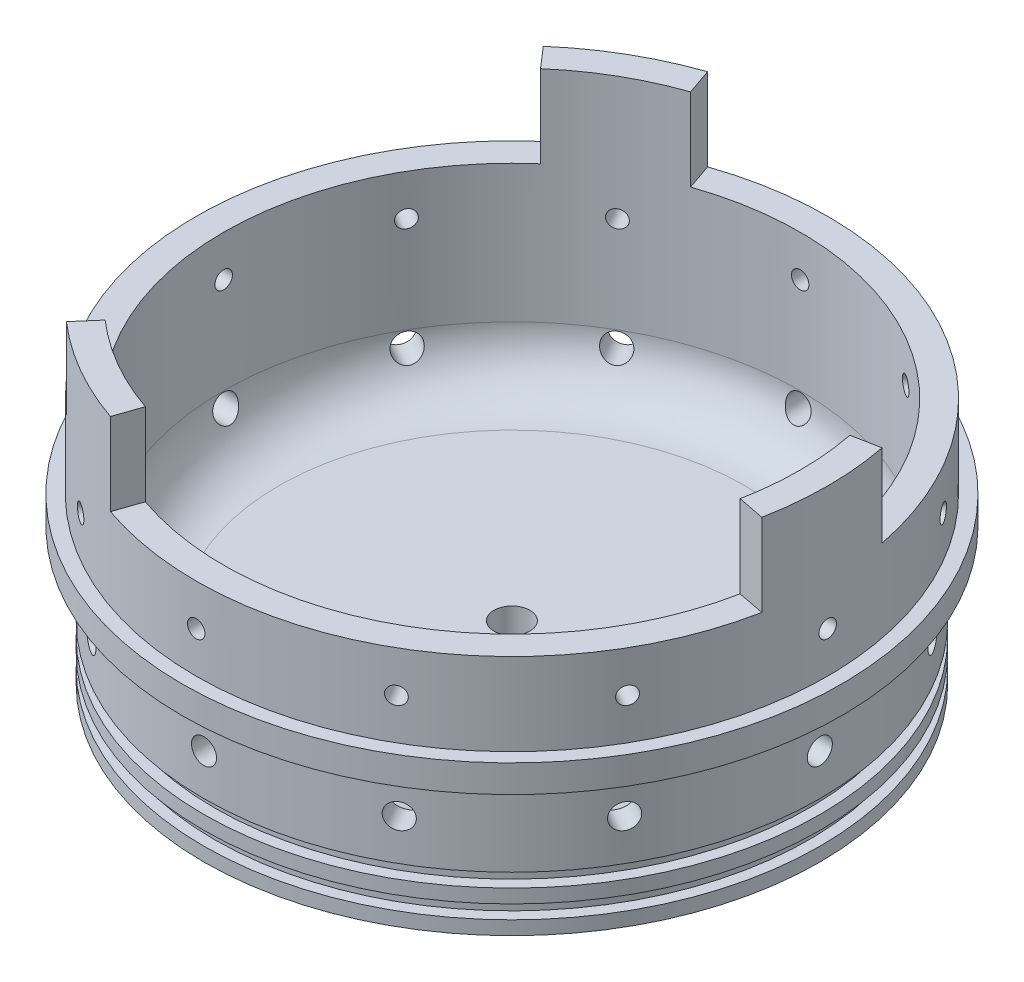
from build123d import *

# Parameters (mm, degrees)
SKETCH1_R                                = 76.2
CENTER_RING_TOTOD_THK_DEPTH              = 6.35
SKETCH2_R                                = 73.025
TOP_RING_ACRYLICID_HGT_DEPTH             = 38.1
SKETCH3_R                                = 71.247
LOWER_RING_TANKID_DEPTH_DEPTH            = 31.75
SKETCH4_R                                = 66.675
BULKHEAD_HOLLOW_UPPERWALL_BLKHDTHK_DEPTH = 63.5
SKETCH5_W                                = 2.54
SKETCH5_H                                = 3.175
SKETCH8_R                                = 2.8956
LOWER_BOLT_HOLE_DRILLDIA_DIST_DEPTH      = 117.570504417
LOWER_BOLT_HOLE_AMMOUNT_COUNT            = 12
SKETCH9_R                                = 2.0193
UPPER_BOLT_HOLE_DRILLDIA_DIST_DEPTH      = 117.570504455
CIRPATTERN1_COUNT                        = 12
SMOOTHING_R                              = 12.7
CUT_EXTRUDE1_DEPTH                       = 19.05
SKETCH11_R                               = 4.1671875
F_1_8NPTHOLE_DEPTH                       = 126.080494134


with BuildPart() as part:
    # Sketch1 → Center Ring(TotOD&Thk) (new body)
    with BuildSketch(Plane(origin=(0, 0, 0), x_dir=(1, 0, 0), z_dir=(0, 1, 0))):
        with Locations(Location((0, 0, 0), (0, 0, 270))):
            Circle(SKETCH1_R)
    extrude(amount=CENTER_RING_TOTOD_THK_DEPTH)

    # Sketch2 → Top Ring(AcrylicID&Hgt) (add)
    with BuildSketch(Plane(origin=(0, 6.35, 0), x_dir=(1, 0, 0), z_dir=(0, 1, 0))):
        with Locations(Location((0, 0, 0), (0, 0, 90))):
            Circle(SKETCH2_R)
    extrude(amount=TOP_RING_ACRYLICID_HGT_DEPTH)

    # Sketch3 → Lower Ring(TankID&Depth) (add)
    with BuildSketch(Plane.XZ):
        with Locations(Location((0, 0, 0), (0, 0, 270))):
            Circle(SKETCH3_R)
    extrude(amount=LOWER_RING_TANKID_DEPTH_DEPTH)

    # Sketch4 → Bulkhead Hollow(UpperWall&BlkhdThk (cut)
    with BuildSketch(Plane(origin=(0, 44.45, 0), x_dir=(1, 0, 0), z_dir=(0, 1, 0))):
        with Locations(Location((0, 0, 0), (0, 0, 270))):
            Circle(SKETCH4_R)
    extrude(amount=-BULKHEAD_HOLLOW_UPPERWALL_BLKHDTHK_DEPTH, mode=Mode.SUBTRACT)

    # Sketch5 → O-Ring Channel (revolve, cut)
    with BuildSketch(Plane.XY, mode=Mode.PRIVATE) as o_ring_channel_sk:
        with Locations((-69.977, -26.9875)):
            Rectangle(SKETCH5_W, SKETCH5_H)
        with Locations((-69.977, -20.6375)):
            Rectangle(SKETCH5_W, SKETCH5_H)
    revolve(o_ring_channel_sk.sketch.rotate(Axis((0, 0, 0), (0, -1, 0)), 270), axis=Axis((0, 0, 0), (0, -1, 0)), mode=Mode.SUBTRACT)

    # Sketch8 → Lower Bolt Hole (DrillDia&Dist) (cut, through all)
    with BuildSketch(Plane.XY):
        with Locations(Location((0, -9.525, 0), (0, 0, 270))):
            Circle(SKETCH8_R)
    lower_bolt_hole_drilldia_dist = extrude(amount=LOWER_BOLT_HOLE_DRILLDIA_DIST_DEPTH, mode=Mode.SUBTRACT)

    # Lower Bolt Hole Ammount: Lower Bolt Hole (DrillDia&Dist) ×12 about axis
    lower_bolt_hole_ammount_axis = Axis((0, -31.75, 0), (0, 1, 0))
    for i in range(1, LOWER_BOLT_HOLE_AMMOUNT_COUNT):
        add(lower_bolt_hole_drilldia_dist.rotate(lower_bolt_hole_ammount_axis, i * 360 / LOWER_BOLT_HOLE_AMMOUNT_COUNT), mode=Mode.SUBTRACT)

    # Sketch9 → Upper Bolt Hole (DrillDia&Dist) (cut, through all)
    with BuildSketch(Plane.XY):
        with Locations((0, 15.875)):
            Circle(SKETCH9_R)
    upper_bolt_hole_drilldia_dist = extrude(amount=-UPPER_BOLT_HOLE_DRILLDIA_DIST_DEPTH, mode=Mode.SUBTRACT)

    # CirPattern1: Upper Bolt Hole (DrillDia&Dist) ×12 about axis
    cirpattern1_axis = Axis((0, 44.45, 0), (0, -1, 0))
    for i in range(1, CIRPATTERN1_COUNT):
        add(upper_bolt_hole_drilldia_dist.rotate(cirpattern1_axis, i * 360 / CIRPATTERN1_COUNT), mode=Mode.SUBTRACT)

    # Smoothing
    # the kernel refuses this fillet: 12.7 mm, written as the material it adds along each edge
    with BuildSketch(Plane(origin=(0, -19.05, 0), x_dir=(0, 0, 1), z_dir=(-1, 0, 0))) as smoothing_piece_1_section:
        with BuildLine():
            CenterArc((66.675 - SMOOTHING_R, SMOOTHING_R), SMOOTHING_R, 270, 90)
            Line((66.675 - SMOOTHING_R, 0), (66.675, 0))
            Line((66.675, 0), (66.675, SMOOTHING_R))
        make_face()
    smoothing_piece_1 = revolve(axis=Axis((0, -19.05, 0), (0, 1, 0)), mode=Mode.PRIVATE)
    smoothing_piece_1 = smoothing_piece_1 - Plane(origin=(0, -9.525, -63.134341745), x_dir=(0, -1, 0), z_dir=(0, 0, 1)) * Cylinder(2.8956, 267, mode=Mode.PRIVATE)
    smoothing_piece_1 = smoothing_piece_1 - Plane(origin=(27.337971901, -9.525, -47.350756309), x_dir=(0, -1, 0), z_dir=(-0.49999999999999994, 0, 0.8660254037844388)) * Cylinder(2.8956, 267, mode=Mode.PRIVATE)
    smoothing_piece_1 = smoothing_piece_1 - Plane(origin=(27.337971901, -9.525, -15.783585436), x_dir=(0, -1, 0), z_dir=(-0.8660254037844388, 0, 0.49999999999999983)) * Cylinder(2.8956, 267, mode=Mode.PRIVATE)
    smoothing_piece_1 = smoothing_piece_1 - Plane(origin=(0, -9.525, 0), x_dir=(0, -1, 0), z_dir=(-1, 0, 0)) * Cylinder(2.8956, 267, mode=Mode.PRIVATE)
    smoothing_piece_1 = smoothing_piece_1 - Plane(origin=(-27.337971901, -9.525, -15.783585436), x_dir=(0, -1, 0), z_dir=(-0.8660254037844386, 0, -0.5000000000000001)) * Cylinder(2.8956, 267, mode=Mode.PRIVATE)
    smoothing_piece_1 = smoothing_piece_1 - Plane(origin=(-27.337971901, -9.525, -47.350756309), x_dir=(0, -1, 0), z_dir=(-0.49999999999999994, 0, -0.8660254037844387)) * Cylinder(2.8956, 267, mode=Mode.PRIVATE)
    add(smoothing_piece_1)

    # Sketch10 → Cut-Extrude1 (cut)
    with BuildSketch(Plane(origin=(0, 44.45, 0), x_dir=(1, 0, 0), z_dir=(0, 1, 0))):
        with BuildLine():
            ThreePointArc((-21.728628275, 63.035088152), (33.3375, 57.742243797), (65.454301807, 12.7))
            Line((65.454301807, 12.7), (71.688044836, 13.90952381))
            ThreePointArc((71.688044836, 13.90952381), (36.5125, 63.241505111), (-23.798021444, 69.03842988))
            Line((-23.798021444, 69.03842988), (-21.728628275, 63.035088152))
        make_face()
        with BuildLine():
            ThreePointArc((-43.725673531, -50.335088152), (-66.675, 0), (-43.725673531, 50.335088152))
            Line((-43.725673531, 50.335088152), (-47.890023392, 55.128906071))
            ThreePointArc((-47.890023392, 55.128906071), (-73.025, 0), (-47.890023392, -55.128906071))
            Line((-47.890023392, -55.128906071), (-43.725673531, -50.335088152))
        make_face()
        with BuildLine():
            Line((71.688044836, -13.90952381), (65.454301807, -12.7))
            ThreePointArc((65.454301807, -12.7), (33.3375, -57.742243797), (-21.728628275, -63.035088152))
            Line((-21.728628275, -63.035088152), (-23.798021444, -69.03842988))
            ThreePointArc((-23.798021444, -69.03842988), (36.5125, -63.241505111), (71.688044836, -13.90952381))
        make_face()
    extrude(amount=-CUT_EXTRUDE1_DEPTH, mode=Mode.SUBTRACT)

    # Sketch11 → 1/8NPTHole (cut, through all)
    with BuildSketch(Plane(origin=(0, -19.05, 0), x_dir=(1, 0, 0), z_dir=(0, 1, 0))):
        with Locations(Location((0, 0, 0), (0, 0, 270))):
            Circle(SKETCH11_R)
    extrude(amount=-F_1_8NPTHOLE_DEPTH, mode=Mode.SUBTRACT)


solid = part.part
